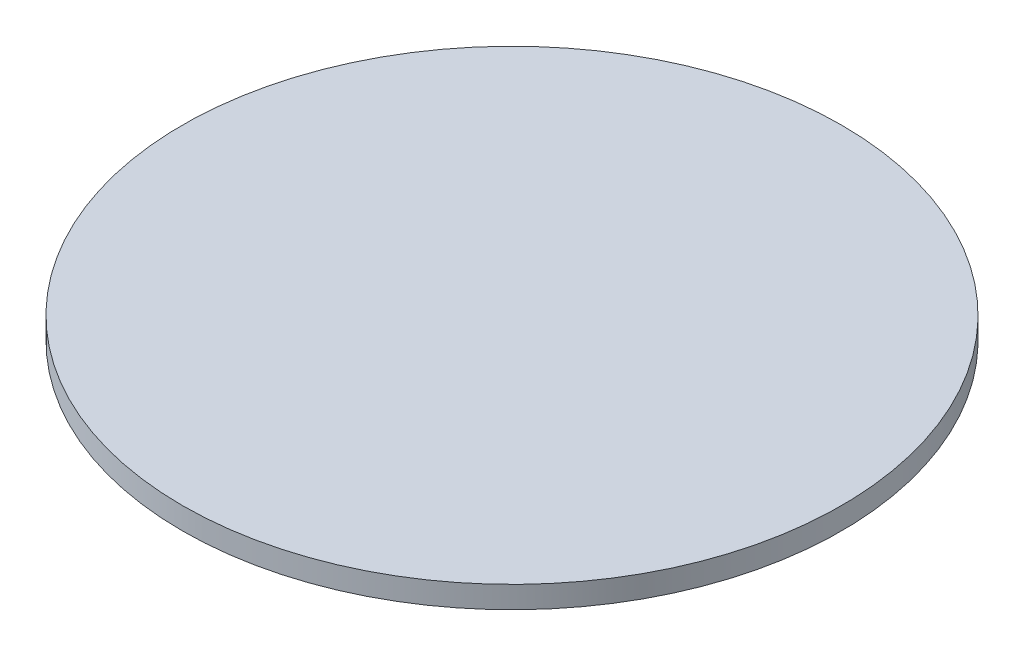
from build123d import *

# Parameters (mm, degrees)
SKETCH1_R           = 75
BOSS_EXTRUDE1_DEPTH = 5


with BuildPart() as part:
    # Sketch1 → Boss-Extrude1 (new body)
    with BuildSketch(Plane(origin=(0, 0, 0), x_dir=(1, 0, 0), z_dir=(0, 1, 0))):
        Circle(SKETCH1_R)
    extrude(amount=BOSS_EXTRUDE1_DEPTH)


solid = part.part
